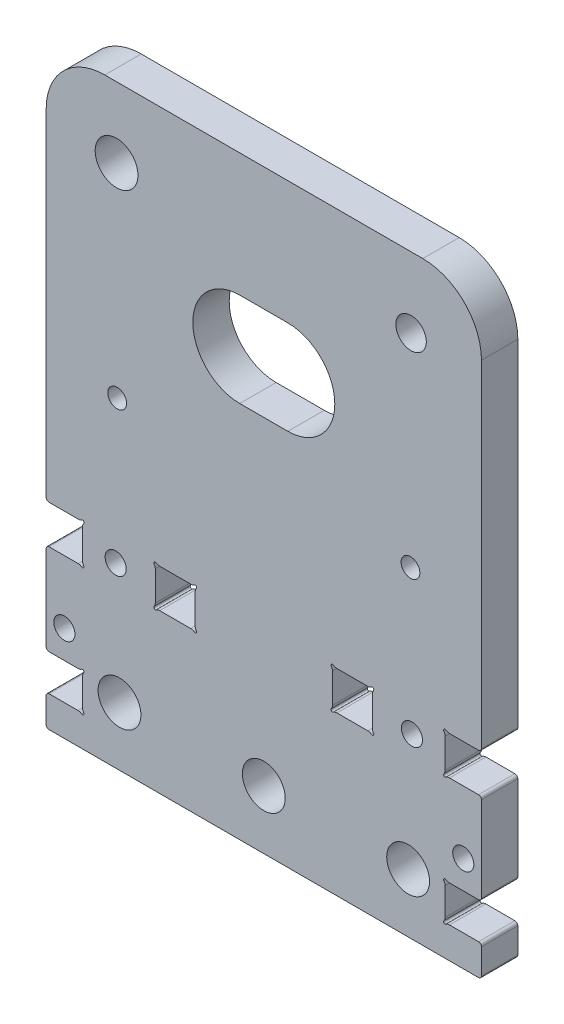
from build123d import *

# Parameters (mm, degrees)
SKETCH1_R           = 3.65
SKETCH1_R_2         = 1.8
SKETCH1_W           = 6.8
SKETCH1_H           = 6.56
SKETCH1_R_3         = 1.6
SKETCH1_R_4         = 2.6
BOSS_EXTRUDE1_DEPTH = 6.2
CUT_EXTRUDE1_DEPTH  = 126.801589815
SKETCH3_R           = 0.25
CUT_EXTRUDE2_DEPTH  = 126.801589815
FILLET1_R           = 1
FILLET2_R           = 0.5


with BuildPart() as part:
    # Sketch1 → Boss-Extrude1 (new body)
    with BuildSketch(Plane.XY):
        with BuildLine():
            Line((0, 5.3), (0, 0))
            Line((0, 0), (74.2, 0))
            Line((74.2, 0), (74.2, 5.3))
            Line((74.2, 5.3), (68, 5.3))
            Line((68, 5.3), (68, 11.5))
            Line((68, 11.5), (74.2, 11.5))
            Line((74.2, 11.5), (74.2, 27))
            Line((74.2, 27), (68, 27))
            Line((68, 27), (68, 33.56))
            Line((68, 33.56), (74.2, 33.56))
            Line((74.2, 33.56), (74.2, 91.4))
            ThreePointArc((74.2, 91.4), (71.271067812, 98.471067812), (64.2, 101.4))
            Line((64.2, 101.4), (10, 101.4))
            ThreePointArc((10, 101.4), (2.928932188, 98.471067812), (0, 91.4))
            Line((0, 91.4), (0, 33.56))
            Line((0, 33.56), (6.2, 33.56))
            Line((6.2, 33.56), (6.2, 27))
            Line((6.2, 27), (0, 27))
            Line((0, 27), (0, 11.5))
            Line((0, 11.5), (6.2, 11.5))
            Line((6.2, 11.5), (6.2, 5.3))
            Line((6.2, 5.3), (0, 5.3))
        make_face()
        with Locations((12.5, 10)):
            Circle(SKETCH1_R, mode=Mode.SUBTRACT)
        with Locations((3.1, 16.28)):
            Circle(SKETCH1_R_2, mode=Mode.SUBTRACT)
        with Locations((11.85, 30.28)):
            Circle(SKETCH1_R_2, mode=Mode.SUBTRACT)
        with Locations((22, 30.28)):
            Rectangle(SKETCH1_W, SKETCH1_H, mode=Mode.SUBTRACT)
        with Locations((37.1, 10)):
            Circle(SKETCH1_R, mode=Mode.SUBTRACT)
        with Locations((61.7, 10)):
            Circle(SKETCH1_R, mode=Mode.SUBTRACT)
        with Locations((71.1, 16.28)):
            Circle(SKETCH1_R_2, mode=Mode.SUBTRACT)
        with Locations((52.2, 30.28)):
            Rectangle(SKETCH1_W, SKETCH1_H, mode=Mode.SUBTRACT)
        with Locations((62.35, 30.28)):
            Circle(SKETCH1_R_2, mode=Mode.SUBTRACT)
        with Locations((12.1, 54.75)):
            Circle(SKETCH1_R_3, mode=Mode.SUBTRACT)
        with Locations((12, 89.4)):
            Circle(SKETCH1_R, mode=Mode.SUBTRACT)
        with Locations((62.1, 54.75)):
            Circle(SKETCH1_R_3, mode=Mode.SUBTRACT)
        with Locations((62.2, 89.4)):
            Circle(SKETCH1_R_4, mode=Mode.SUBTRACT)
    extrude(amount=BOSS_EXTRUDE1_DEPTH)

    # Sketch2 → Cut-Extrude1 (cut, through all)
    with BuildSketch(Plane.XY.offset(6.2)):
        with BuildLine():
            Line((33, 80.4), (41.2, 80.4))
            ThreePointArc((41.2, 80.4), (49.2, 72.4), (41.2, 64.4))
            Line((41.2, 64.4), (33, 64.4))
            ThreePointArc((33, 64.4), (25, 72.4), (33, 80.4))
        make_face()
    extrude(amount=-CUT_EXTRUDE1_DEPTH, mode=Mode.SUBTRACT)

    # Sketch3 → Cut-Extrude2 (cut, through all)
    with BuildSketch(Plane.XY.offset(6.2)):
        with Locations((6.2, 33.56)):
            Circle(SKETCH3_R)
        with Locations((6.2, 27)):
            Circle(SKETCH3_R)
        with Locations((6.2, 11.5)):
            Circle(SKETCH3_R)
        with Locations((6.2, 5.3)):
            Circle(SKETCH3_R)
        with Locations((25.4, 27)):
            Circle(SKETCH3_R)
        with Locations((18.6, 27)):
            Circle(SKETCH3_R)
        with Locations((18.6, 33.56)):
            Circle(SKETCH3_R)
        with Locations((25.4, 33.56)):
            Circle(SKETCH3_R)
        with Locations((48.8, 33.56)):
            Circle(SKETCH3_R)
        with Locations((48.8, 27)):
            Circle(SKETCH3_R)
        with Locations((55.6, 33.56)):
            Circle(SKETCH3_R)
        with Locations((55.6, 27)):
            Circle(SKETCH3_R)
        with Locations((68, 33.56)):
            Circle(SKETCH3_R)
        with Locations((68, 27)):
            Circle(SKETCH3_R)
        with Locations((68, 11.5)):
            Circle(SKETCH3_R)
        with Locations((68, 5.3)):
            Circle(SKETCH3_R)
    extrude(amount=-CUT_EXTRUDE2_DEPTH, mode=Mode.SUBTRACT)

    # Fillet1
    fillet1_edges = [part.edges().sort_by_distance(p)[0] for p in [
        (5.95, 11.5, 3.1),
        (6.2, 11.25, 3.1),
        (6.2, 5.55, 3.1),
        (5.95, 5.3, 3.1),
        (68, 5.55, 3.1),
        (68.25, 5.3, 3.1),
        (68, 11.25, 3.1),
        (68.25, 11.5, 3.1),
        (68.25, 33.56, 3.1),
        (68, 33.31, 3.1),
        (68, 27.25, 3.1),
        (68.25, 27, 3.1),
        (48.8, 27.25, 3.1),
        (48.8, 33.31, 3.1),
        (49.05, 33.56, 3.1),
        (55.35, 33.56, 3.1),
        (55.6, 33.31, 3.1),
        (55.6, 27.25, 3.1),
        (55.35, 27, 3.1),
        (49.05, 27, 3.1),
        (18.6, 27.25, 3.1),
        (18.85, 27, 3.1),
        (25.15, 27, 3.1),
        (25.4, 27.25, 3.1),
        (25.4, 33.31, 3.1),
        (25.15, 33.56, 3.1),
        (18.85, 33.56, 3.1),
        (18.6, 33.31, 3.1),
        (5.95, 33.56, 3.1),
        (6.2, 33.31, 3.1),
        (6.2, 27.25, 3.1),
        (5.95, 27, 3.1),
    ]]
    fillet(fillet1_edges, radius=FILLET1_R)

    # Fillet2
    fillet2_edges = [part.edges().sort_by_distance(p)[0] for p in [
        (0, 0, 3.1),
        (74.2, 0, 3.1),
        (74.2, 33.56, 3.1),
        (74.2, 27, 3.1),
        (74.2, 5.3, 3.1),
        (74.2, 11.5, 3.1),
        (0, 5.3, 3.1),
        (0, 11.5, 3.1),
        (0, 33.56, 3.1),
        (0, 27, 3.1),
    ]]
    fillet(fillet2_edges, radius=FILLET2_R)


solid = part.part
